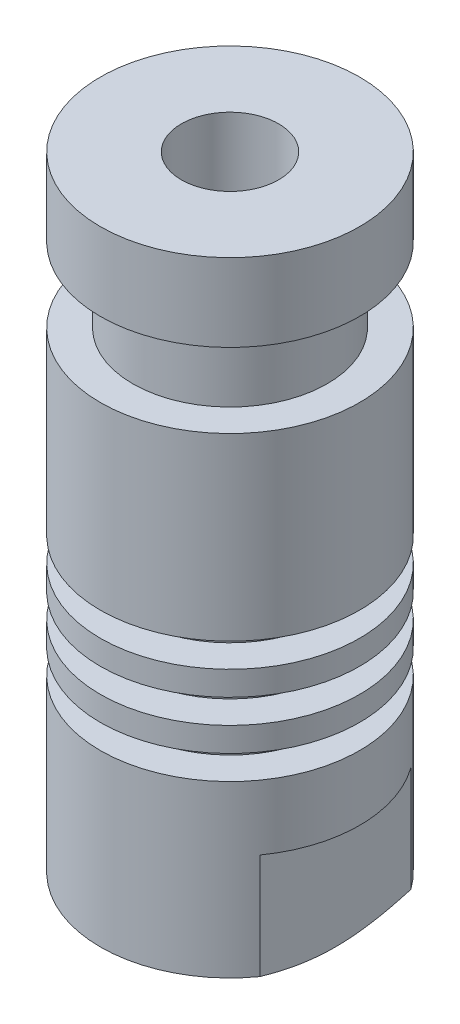
from build123d import *

# Parameters (mm, degrees)
TAGLIO_ESTRUSIONE1_REACH             = 43.569
SCHIZZO2_W                           = 1.5
SCHIZZO2_H                           = 8
TAGLIO_ESTRUSIONE1_DIRECTION_2_REACH = 43.569
SCHIZZO7_R                           = 3
TAGLIO_ESTRUSIONE2_DEPTH             = 42.569219382
FORO_FILETTATO_M8_1_D                = 6.8
FORO_FILETTATO_M8_1_DEPTH            = 12
FORO_FILETTATO_M8_1_TIP              = 2.042926105


with BuildPart() as part:
    # Schizzo1 → Rivoluzione1 (revolve)
    with BuildSketch(Plane.XY):
        Polygon((0, 0), (-5, 0), (-8, 1.5), (-8, 12), (-6, 12), (-6, 13.5), (-8, 13.5), (-8, 15), (-6, 15), (-6, 16.5), (-8, 16.5), (-8, 18), (-6, 18), (-6, 19.5), (-8, 19.5), (-8, 30.6), (-6, 30.6), (-6, 35.2), (-8, 35.2), (-8, 40), (0, 40), align=None)
    revolve(axis=Axis((0, 129.407380346, 0), (0, -1, 0)))

    # Schizzo2 → Taglio-Estrusione1 (cut, up to next)
    with BuildSketch(Plane.XY, mode=Mode.PRIVATE) as taglio_estrusione1_sk1:
        with Locations((-7.25, 4)):
            Rectangle(SCHIZZO2_W, SCHIZZO2_H)
    taglio_estrusione1_tool1 = extrude(taglio_estrusione1_sk1.sketch, amount=-TAGLIO_ESTRUSIONE1_REACH, mode=Mode.PRIVATE) & part.part
    # Schizzo2 → Taglio-Estrusione1 (cut, up to next)
    with BuildSketch(Plane.XY, mode=Mode.PRIVATE) as taglio_estrusione1_sk2:
        with Locations((7.25, 4)):
            Rectangle(SCHIZZO2_W, SCHIZZO2_H)
    taglio_estrusione1_tool2 = extrude(taglio_estrusione1_sk2.sketch, amount=-TAGLIO_ESTRUSIONE1_REACH, mode=Mode.PRIVATE) & part.part
    add(taglio_estrusione1_tool1.solids().sort_by_distance((-7.25, 4, 0))[0], mode=Mode.SUBTRACT)
    add(taglio_estrusione1_tool2.solids().sort_by_distance((7.25, 4, 0))[0], mode=Mode.SUBTRACT)

    # Schizzo2 → Taglio-Estrusione1 direction 2 (cut, up to next)
    with BuildSketch(Plane.XY, mode=Mode.PRIVATE) as taglio_estrusione1_direction_2_sk1:
        with Locations((-7.25, 4)):
            Rectangle(SCHIZZO2_W, SCHIZZO2_H)
    taglio_estrusione1_direction_2_tool1 = extrude(taglio_estrusione1_direction_2_sk1.sketch, amount=TAGLIO_ESTRUSIONE1_DIRECTION_2_REACH, mode=Mode.PRIVATE) & part.part
    # Schizzo2 → Taglio-Estrusione1 direction 2 (cut, up to next)
    with BuildSketch(Plane.XY, mode=Mode.PRIVATE) as taglio_estrusione1_direction_2_sk2:
        with Locations((7.25, 4)):
            Rectangle(SCHIZZO2_W, SCHIZZO2_H)
    taglio_estrusione1_direction_2_tool2 = extrude(taglio_estrusione1_direction_2_sk2.sketch, amount=TAGLIO_ESTRUSIONE1_DIRECTION_2_REACH, mode=Mode.PRIVATE) & part.part
    add(taglio_estrusione1_direction_2_tool1.solids().sort_by_distance((-7.25, 4, 0))[0], mode=Mode.SUBTRACT)
    add(taglio_estrusione1_direction_2_tool2.solids().sort_by_distance((7.25, 4, 0))[0], mode=Mode.SUBTRACT)

    # Schizzo7 → Taglio-Estrusione2 (cut, through all)
    with BuildSketch(Plane(origin=(0, 40, 0), x_dir=(1, 0, 0), z_dir=(0, 1, 0))):
        Circle(SCHIZZO7_R)
    extrude(amount=-TAGLIO_ESTRUSIONE2_DEPTH, mode=Mode.SUBTRACT)

    # Foro filettato M8-1
    with Locations(Plane(origin=(0, 0, 0), x_dir=(-1, 0, 0), z_dir=(0, -1, 0))):
        with Locations((0, 0)):
            Hole(FORO_FILETTATO_M8_1_D / 2, depth=FORO_FILETTATO_M8_1_DEPTH)
            with Locations((0, 0, -(FORO_FILETTATO_M8_1_DEPTH + FORO_FILETTATO_M8_1_TIP / 2))):  # 118° drill point
                Cone(0, FORO_FILETTATO_M8_1_D / 2, FORO_FILETTATO_M8_1_TIP, mode=Mode.SUBTRACT)


solid = part.part
